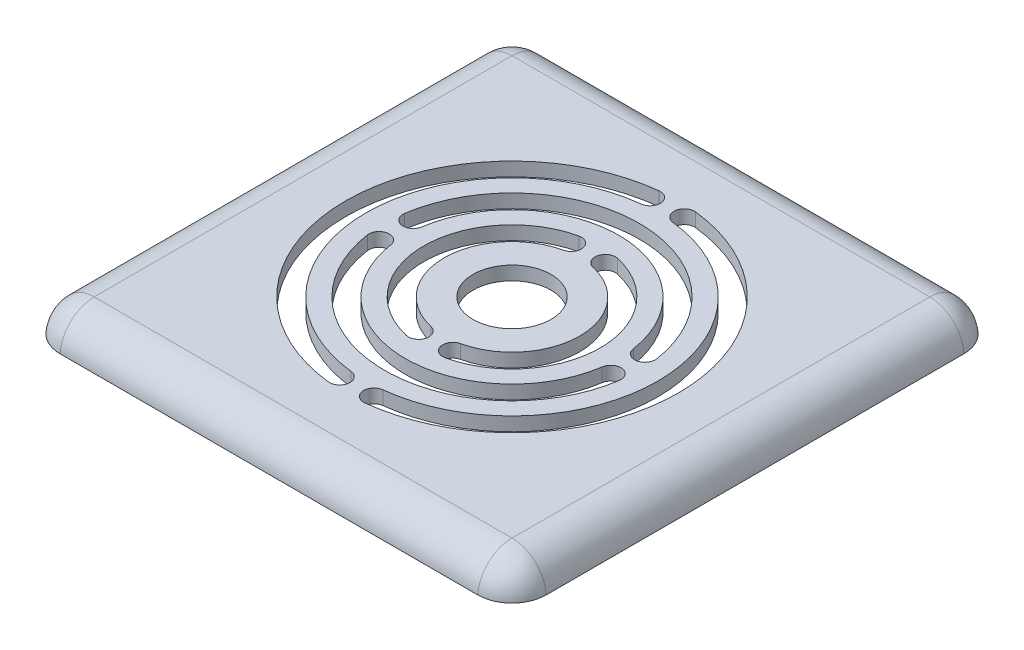
from build123d import *

# Parameters (mm, degrees)
EXTRUDE_1_DEPTH     = 4.7
FILLET_1_R          = 5
SKETCH_2_R          = 29.5
CUT_EXTRUDE_1_DEPTH = 2.7
SKETCH_3_R          = 5.7
CUT_EXTRUDE_2_DEPTH = 51.42410138


with BuildPart() as part:
    # Эскиз1 → Бобышка-Вытянуть1 (new body)
    with BuildSketch(Plane(origin=(0, 0, 0), x_dir=(1, 0, 0), z_dir=(0, 1, 0))):
        with BuildLine():
            Line((-30.5, 35.5), (30.5, 35.5))
            ThreePointArc((30.5, 35.5), (34.035533906, 34.035533906), (35.5, 30.5))
            Line((35.5, 30.5), (35.5, -30.5))
            ThreePointArc((35.5, -30.5), (34.035533906, -34.035533906), (30.5, -35.5))
            Line((30.5, -35.5), (-30.5, -35.5))
            ThreePointArc((-30.5, -35.5), (-34.035533906, -34.035533906), (-35.5, -30.5))
            Line((-35.5, -30.5), (-35.5, 30.5))
            ThreePointArc((-35.5, 30.5), (-34.035533906, 34.035533906), (-30.5, 35.5))
        make_face()
    extrude(amount=EXTRUDE_1_DEPTH)

    # Скругление1
    # the kernel refuses this fillet: 5 mm, written as the material it takes off along each edge
    with BuildSketch(Plane(origin=(-30.5, 4.7, 30.5), x_dir=(0, 0, 1), z_dir=(1, 0, 0))) as fillet_1_piece_1:
        with BuildLine():
            CenterArc((0.009008115, 5), FILLET_1_R, 270, 86.560187232)
            Line((0.009008115, 0), (0.009008115, -0.1))
            Line((0.009008115, -0.1), (5, -0.1))
            Line((5, -0.1), (5.1, 0))
            ThreePointArc((5.1, 0), (5.1, 2.35), (5.099819838, 4.694))
            Line((5.099819838, 4.694), (5, 4.7))
        make_face()
    revolve(axis=Axis((-30.5, 4.7, 30.5), (0, -1, 0)), revolution_arc=90, mode=Mode.SUBTRACT)
    with BuildSketch(Plane(origin=(-35.5, 4.7, 30.5), x_dir=(0, -1, 0), z_dir=(0, 0, -1)), Plane(origin=(-30.5, 4.7, -35.5), x_dir=(0, -1, 0), z_dir=(1, 0, 0)), Plane(origin=(35.5, 4.7, -30.5), x_dir=(0, -1, 0), z_dir=(0, 0, 1)), Plane(origin=(30.5, 4.7, 35.5), x_dir=(0, -1, 0), z_dir=(-1, 0, 0))) as fillet_1_piece_2:
        with BuildLine():
            CenterArc((5, -4.990991885), FILLET_1_R, 93.439812768, 86.560187232)
            Line((0, -4.990991885), (-0.1, -4.990991885))
            Line((-0.1, -4.990991885), (-0.1, 0))
            Line((-0.1, 0), (0, 0.1))
            ThreePointArc((0, 0.1), (2.35, 0.1), (4.694, 0.099819838))
            Line((4.694, 0.099819838), (4.7, 0))
        make_face()
    extrude(amount=61, mode=Mode.SUBTRACT)
    with BuildSketch(Plane(origin=(-30.5, 4.7, -30.5), x_dir=(-1, 0, 0), z_dir=(0, 0, 1))) as fillet_1_piece_3:
        with BuildLine():
            CenterArc((0.009008115, 5), FILLET_1_R, 270, 86.560187232)
            Line((0.009008115, 0), (0.009008115, -0.1))
            Line((0.009008115, -0.1), (5, -0.1))
            Line((5, -0.1), (5.1, 0))
            ThreePointArc((5.1, 0), (5.1, 2.35), (5.099819838, 4.694))
            Line((5.099819838, 4.694), (5, 4.7))
        make_face()
    revolve(axis=Axis((-30.5, 4.7, -30.5), (0, -1, 0)), revolution_arc=90, mode=Mode.SUBTRACT)
    with BuildSketch(Plane(origin=(30.5, 4.7, -30.5), x_dir=(0, 0, -1), z_dir=(-1, 0, 0))) as fillet_1_piece_4:
        with BuildLine():
            CenterArc((0.009008115, 5), FILLET_1_R, 270, 86.560187232)
            Line((0.009008115, 0), (0.009008115, -0.1))
            Line((0.009008115, -0.1), (5, -0.1))
            Line((5, -0.1), (5.1, 0))
            ThreePointArc((5.1, 0), (5.1, 2.35), (5.099819838, 4.694))
            Line((5.099819838, 4.694), (5, 4.7))
        make_face()
    revolve(axis=Axis((30.5, 4.7, -30.5), (0, -1, 0)), revolution_arc=90, mode=Mode.SUBTRACT)
    with BuildSketch(Plane(origin=(30.5, 4.7, 30.5), x_dir=(1, 0, 0), z_dir=(0, 0, -1))) as fillet_1_piece_5:
        with BuildLine():
            CenterArc((0.009008115, 5), FILLET_1_R, 270, 86.560187232)
            Line((0.009008115, 0), (0.009008115, -0.1))
            Line((0.009008115, -0.1), (5, -0.1))
            Line((5, -0.1), (5.1, 0))
            ThreePointArc((5.1, 0), (5.1, 2.35), (5.099819838, 4.694))
            Line((5.099819838, 4.694), (5, 4.7))
        make_face()
    revolve(axis=Axis((30.5, 4.7, 30.5), (0, -1, 0)), revolution_arc=90, mode=Mode.SUBTRACT)

    # Эскиз2 → Вырез-Вытянуть1 (cut)
    with BuildSketch(Plane(origin=(0, 0, 0), x_dir=(1, 0, 0), z_dir=(0, 1, 0))):
        with Locations(Location((0, 0, 0), (0, 0, 90))):
            Circle(SKETCH_2_R)
    extrude(amount=CUT_EXTRUDE_1_DEPTH, mode=Mode.SUBTRACT)

    # Эскиз3 → Вырез-Вытянуть2 (cut, through all)
    with BuildSketch(Plane(origin=(0, 4.7, 0), x_dir=(1, 0, 0), z_dir=(0, 1, 0))):
        with Locations(Location((0, 0, 0), (0, 0, 270))):
            Circle(SKETCH_3_R)
        with BuildLine():
            ThreePointArc((2.828947368, -12.585986524), (12.9, 0), (2.828947368, 12.585986524))
            ThreePointArc((2.828947368, 12.585986524), (1.036513195, 11.451447087), (2.171052632, 9.659012914))
            ThreePointArc((2.171052632, 9.659012914), (9.9, 0), (2.171052632, -9.659012914))
            ThreePointArc((2.171052632, -9.659012914), (1.036513195, -11.451447087), (2.828947368, -12.585986524))
        make_face()
        with BuildLine():
            ThreePointArc((-2.828947368, 12.585986524), (-12.9, 0), (-2.828947368, -12.585986524))
            ThreePointArc((-2.828947368, -12.585986524), (-1.036513195, -11.451447087), (-2.171052632, -9.659012914))
            ThreePointArc((-2.171052632, -9.659012914), (-9.9, 0), (-2.171052632, 9.659012914))
            ThreePointArc((-2.171052632, 9.659012914), (-1.036513195, 11.451447087), (-2.828947368, 12.585986524))
        make_face()
        with BuildLine():
            ThreePointArc((18.400147202, 2.719298246), (0, 18.6), (-18.400147202, 2.719298246))
            ThreePointArc((-18.400147202, 2.719298246), (-17.135562609, 1.016117161), (-15.432381524, 2.280701754))
            ThreePointArc((-15.432381524, 2.280701754), (0, 15.6), (15.432381524, 2.280701754))
            ThreePointArc((15.432381524, 2.280701754), (17.135562609, 1.016117161), (18.400147202, 2.719298246))
        make_face()
        with BuildLine():
            ThreePointArc((-18.400147202, -2.719298246), (0, -18.6), (18.400147202, -2.719298246))
            ThreePointArc((18.400147202, -2.719298246), (17.135562609, -1.016117161), (15.432381524, -2.280701754))
            ThreePointArc((15.432381524, -2.280701754), (0, -15.6), (-15.432381524, -2.280701754))
            ThreePointArc((-15.432381524, -2.280701754), (-17.135562609, -1.016117161), (-18.400147202, -2.719298246))
        make_face()
        with BuildLine():
            ThreePointArc((-2.664473684, 24.153479666), (-24.3, 0), (-2.664473684, -24.153479666))
            ThreePointArc((-2.664473684, -24.153479666), (-1.009044465, -22.826997815), (-2.335526316, -21.171568596))
            ThreePointArc((-2.335526316, -21.171568596), (-21.3, 0), (-2.335526316, 21.171568596))
            ThreePointArc((-2.335526316, 21.171568596), (-1.009044465, 22.826997815), (-2.664473684, 24.153479666))
        make_face()
        with BuildLine():
            ThreePointArc((2.664473684, -24.153479666), (24.3, 0), (2.664473684, 24.153479666))
            ThreePointArc((2.664473684, 24.153479666), (1.009044465, 22.826997815), (2.335526316, 21.171568596))
            ThreePointArc((2.335526316, 21.171568596), (21.3, 0), (2.335526316, -21.171568596))
            ThreePointArc((2.335526316, -21.171568596), (1.009044465, -22.826997815), (2.664473684, -24.153479666))
        make_face()
    extrude(amount=-CUT_EXTRUDE_2_DEPTH, mode=Mode.SUBTRACT)


solid = part.part
